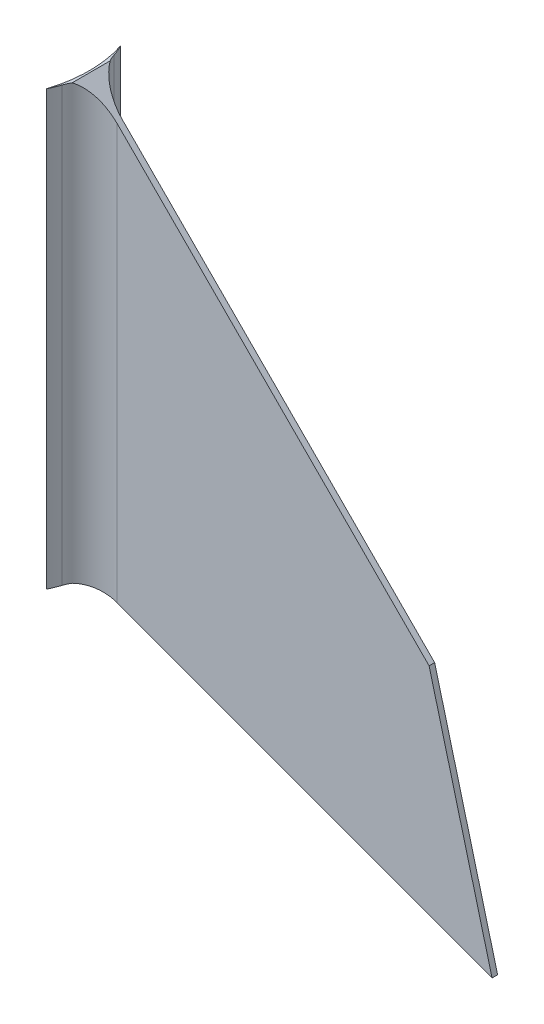
from build123d import *

# Parameters (mm, degrees)
BOSS_EXTRUDE1_DEPTH      = 1.5
BOSS_EXTRUDE1_DEPTH_BACK = 1.5
BOSS_EXTRUDE2_DEPTH      = 234
FILLET1_R                = 37
FILLET2_R                = 37
FILLET3_R                = 18
FILLET4_R                = 18


with BuildPart() as part:
    # Sketch1 → Boss-Extrude1 (new, two sides: drawn at the far end of the back side and taken through both)
    with BuildSketch(Plane.XY.offset(-BOSS_EXTRUDE1_DEPTH_BACK)):
        Polygon((0, 0), (0, 234), (184, 49), (218, -80), align=None)
    extrude(amount=BOSS_EXTRUDE1_DEPTH + BOSS_EXTRUDE1_DEPTH_BACK)

    # Sketch3 → Boss-Extrude2 (add)
    with BuildSketch(Plane(origin=(0, 0, 0), x_dir=(1, 0, 0), z_dir=(0, 1, 0))):
        with BuildLine():
            Line((0, 0), (0, 20))
            Line((0, 20), (-4.153415616, 20))
            ThreePointArc((-4.153415616, 20), (-1, 0), (-4.153415616, -20))
            Line((-4.153415616, -20), (0, -20))
            Line((0, -20), (0, 0))
        make_face()
    extrude(amount=BOSS_EXTRUDE2_DEPTH)

    # Fillet1
    # the kernel refuses this fillet: 37 mm, written as the material it takes off along each edge
    with BuildSketch(Plane(origin=(0, -42.580944556, -20), x_dir=(-1, 0, 0), z_dir=(0, 1, 0))) as fillet1_piece_1:
        with BuildLine():
            CenterArc((37, 17.032377822), FILLET1_R, 180, 27.408696588)
            Line((0, 17.032377822), (-0.74, 17.032377822))
            Line((-0.74, 17.032377822), (-0.74, 0))
            Line((-0.74, 0), (0, -0.74))
            ThreePointArc((0, -0.74), (2.076707808, -0.74), (3.496483928, -0.340647556))
            Line((3.496483928, -0.340647556), (4.153415616, 0))
        make_face()
    extrude(amount=319.161889112, mode=Mode.SUBTRACT)

    # Fillet2
    # the kernel refuses this fillet: 37 mm, written as the material it takes off along each edge
    with BuildSketch(Plane(origin=(0, -42.580944556, 20), x_dir=(-1, 0, 0), z_dir=(0, 1, 0))) as fillet2_piece_1:
        with BuildLine():
            CenterArc((37, -17.032377822), FILLET2_R, 152.591303412, 27.408696588)
            Line((0, -17.032377822), (-0.74, -17.032377822))
            Line((-0.74, -17.032377822), (-0.74, 0))
            Line((-0.74, 0), (0, 0.74))
            ThreePointArc((0, 0.74), (2.076707808, 0.74), (3.496483928, 0.340647556))
            Line((3.496483928, 0.340647556), (4.153415616, 0))
        make_face()
    extrude(amount=319.161889112, mode=Mode.SUBTRACT)

    # Fillet3
    # the kernel refuses this fillet: 18 mm, written as the material it adds along each edge
    with BuildSketch(Plane(origin=(0, -38.641156858, 1.5), x_dir=(-0.13467815592130583, 0, 0.990889395602575), z_dir=(0, 1, 0))) as fillet3_piece_1_section:
        with BuildLine():
            CenterArc((15.754361222, 17.739851832), FILLET3_R, 187.740009623, 72.507035508)
            Line((-2.081647899, 15.315645026), (-3.865248811, 15.073224345))
            Line((-3.865248811, 15.073224345), (-1.783600912, -0.242420681))
            Line((-1.783600912, -0.242420681), (0.242420681, -1.783600912))
            ThreePointArc((0.242420681, -1.783600912), (1.696671933, -1.585944264), (12.40023467, -1.773985183))
            Line((12.40023467, -1.773985183), (12.705155265, 0))
        make_face()
    fillet3_piece_1 = extrude(amount=272.641156858, mode=Mode.PRIVATE)
    fillet3_piece_1 = fillet3_piece_1 - Plane(origin=(-66, -0.945349387, 0), x_dir=(0.9514859136040758, 0, -0.3076923076923073), z_dir=(0, -1, 0)) * Cylinder(65, 607, mode=Mode.PRIVATE)
    fillet3_piece_1 = split(fillet3_piece_1, bisect_by=Plane(origin=(6.079958866, -2.231177565, 3.815463773), z_dir=(0.34450770303612605, 0.9387834907734437, 0)), keep=Keep.TOP, mode=Mode.PRIVATE)
    fillet3_piece_1 = split(fillet3_piece_1, bisect_by=Plane(origin=(120.729104933, 112.614758628, 3.815463773), z_dir=(-0.7090204561204898, -0.7051879131144355, 0)), keep=Keep.TOP, mode=Mode.PRIVATE)
    add(fillet3_piece_1)
    with BuildSketch(Plane(origin=(0, 0, 1.5), x_dir=(-0.1346781559213058, 0, 0.990889395602575), z_dir=(0, 1, 0))) as fillet3_piece_2_section:
        with BuildLine():
            CenterArc((15.754361222, 17.739851832), FILLET3_R, 187.740009623, 72.507035508)
            Line((-2.081647899, 15.315645026), (-3.865248811, 15.073224345))
            Line((-3.865248811, 15.073224345), (-1.783600912, -0.242420681))
            Line((-1.783600912, -0.242420681), (0.242420681, -1.783600912))
            ThreePointArc((0.242420681, -1.783600912), (1.696671933, -1.585944264), (12.40023467, -1.773985183))
            Line((12.40023467, -1.773985183), (12.705155265, 0))
        make_face()
    fillet3_piece_2 = extrude(amount=272.641156858, mode=Mode.PRIVATE)
    fillet3_piece_2 = fillet3_piece_2 - Plane(origin=(-66, 0.313964565, 0), x_dir=(0.9514859136040758, 0, -0.3076923076923073), z_dir=(0, -1, 0)) * Cylinder(65, 607, mode=Mode.PRIVATE)
    fillet3_piece_2 = split(fillet3_piece_2, bisect_by=Plane(origin=(-0.982422038, 0.360521849, 12.117700452), z_dir=(-0.34450770303612605, -0.9387834907734437, 0)), keep=Keep.TOP, mode=Mode.PRIVATE)
    add(fillet3_piece_2)

    # Fillet4
    # the kernel refuses this fillet: 18 mm, written as the material it adds along each edge
    with BuildSketch(Plane(origin=(0, -38.641156858, -1.5), x_dir=(-0.1346781559213057, 0, -0.990889395602575), z_dir=(0, 1, 0))) as fillet4_piece_1_section:
        with BuildLine():
            CenterArc((15.754361222, -17.739851832), FILLET4_R, 99.752954869, 72.507035508)
            Line((-2.081647899, -15.315645026), (-3.865248811, -15.073224345))
            Line((-3.865248811, -15.073224345), (-1.783600912, 0.242420681))
            Line((-1.783600912, 0.242420681), (0.242420681, 1.783600912))
            ThreePointArc((0.242420681, 1.783600912), (1.696671933, 1.585944264), (12.40023467, 1.773985183))
            Line((12.40023467, 1.773985183), (12.705155265, 0))
        make_face()
    fillet4_piece_1 = extrude(amount=272.641156858, mode=Mode.PRIVATE)
    fillet4_piece_1 = fillet4_piece_1 - Plane(origin=(-66, -0.945349387, 0), x_dir=(0.9514859136040758, 0, -0.3076923076923073), z_dir=(0, -1, 0)) * Cylinder(65, 607, mode=Mode.PRIVATE)
    fillet4_piece_1 = split(fillet4_piece_1, bisect_by=Plane(origin=(120.729104933, 112.614758628, -3.815463773), z_dir=(-0.709020456120464, -0.7051879131144615, 0)), keep=Keep.TOP, mode=Mode.PRIVATE)
    fillet4_piece_1 = split(fillet4_piece_1, bisect_by=Plane(origin=(6.079958866, -2.231177565, -3.815463773), z_dir=(0.34450770303615846, 0.9387834907734318, 0)), keep=Keep.TOP, mode=Mode.PRIVATE)
    add(fillet4_piece_1)
    with BuildSketch(Plane(origin=(0, 0, -1.5), x_dir=(-0.13467815592130572, 0, -0.990889395602575), z_dir=(0, 1, 0))) as fillet4_piece_2_section:
        with BuildLine():
            CenterArc((15.754361222, -17.739851832), FILLET4_R, 99.752954869, 72.507035508)
            Line((-2.081647899, -15.315645026), (-3.865248811, -15.073224345))
            Line((-3.865248811, -15.073224345), (-1.783600912, 0.242420681))
            Line((-1.783600912, 0.242420681), (0.242420681, 1.783600912))
            ThreePointArc((0.242420681, 1.783600912), (1.696671933, 1.585944264), (12.40023467, 1.773985183))
            Line((12.40023467, 1.773985183), (12.705155265, 0))
        make_face()
    fillet4_piece_2 = extrude(amount=272.641156858, mode=Mode.PRIVATE)
    fillet4_piece_2 = fillet4_piece_2 - Plane(origin=(-66, 0.313964565, 0), x_dir=(0.9514859136040758, 0, -0.3076923076923073), z_dir=(0, -1, 0)) * Cylinder(65, 607, mode=Mode.PRIVATE)
    fillet4_piece_2 = split(fillet4_piece_2, bisect_by=Plane(origin=(-0.982422038, 0.360521849, -12.117700452), z_dir=(-0.34450770303615846, -0.9387834907734318, 0)), keep=Keep.TOP, mode=Mode.PRIVATE)
    add(fillet4_piece_2)


solid = part.part
